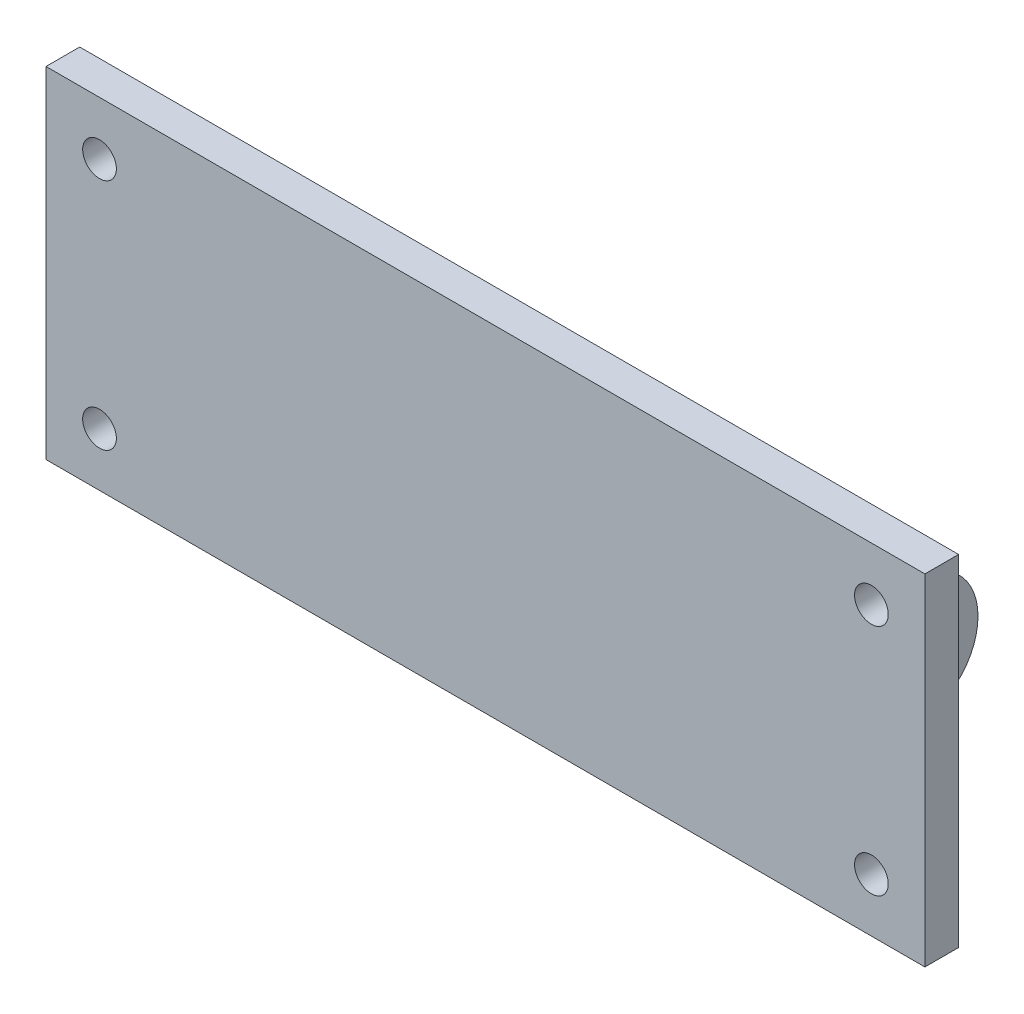
from build123d import *

# Parameters (mm, degrees)
SKETCH1_W           = 208.6
SKETCH1_H           = 80.8
SKETCH1_R           = 4
SKETCH1_W_2         = 20
SKETCH1_H_2         = 30
BOSS_EXTRUDE1_DEPTH = 8
SKETCH1_3_W         = 20
SKETCH1_3_H         = 30
BOSS_EXTRUDE2_DEPTH = 30
FILLET1_R           = 5
FILLET2_R           = 15
SKETCH2_R           = 5
CUT_EXTRUDE1_DEPTH  = 462.279122908


with BuildPart() as part:
    # Sketch1 → Boss-Extrude1 (new body)
    # profile 1 of 3: a face of its own
    with BuildSketch(Plane.XY):
        with Locations((21.844388387, -381.87501611)):
            Rectangle(SKETCH1_W, SKETCH1_H)
        with Locations((113.444388387, -409.57501611)):
            Circle(SKETCH1_R, mode=Mode.SUBTRACT)
        with Locations((-69.755611613, -354.17501611)):
            Circle(SKETCH1_R, mode=Mode.SUBTRACT)
        with Locations((-69.755611613, -409.57501611)):
            Circle(SKETCH1_R, mode=Mode.SUBTRACT)
        with Locations((113.444388387, -354.17501611)):
            Circle(SKETCH1_R, mode=Mode.SUBTRACT)
        with Locations((90.744388387, -381.87501611)):
            Rectangle(SKETCH1_W_2, SKETCH1_H_2, mode=Mode.SUBTRACT)
        with Locations((-47.055611613, -381.87501611)):
            Rectangle(SKETCH1_W_2, SKETCH1_H_2, mode=Mode.SUBTRACT)
    # profile 2 of 3: a face of its own
    with BuildSketch(Plane.XY):
        with Locations((-47.055611613, -381.87501611)):
            Rectangle(SKETCH1_W_2, SKETCH1_H_2)
    # profile 3 of 3: a face of its own
    with BuildSketch(Plane.XY):
        with Locations((90.744388387, -381.87501611)):
            Rectangle(SKETCH1_W_2, SKETCH1_H_2)
    extrude(amount=BOSS_EXTRUDE1_DEPTH)

    # Sketch1<3> → Boss-Extrude2 (add)
    with BuildSketch(Plane.XY):
        with Locations((90.744388387, -381.87501611)):
            Rectangle(SKETCH1_3_W, SKETCH1_3_H)
        with Locations((-47.055611613, -381.87501611)):
            Rectangle(SKETCH1_3_W, SKETCH1_3_H)
    extrude(amount=-BOSS_EXTRUDE2_DEPTH)

    # Fillet1
    fillet1_edges = [part.edges().sort_by_distance(p)[0] for p in [
        (90.744388387, -366.87501611, 0),
        (90.744388387, -396.87501611, 0),
        (-47.055611613, -366.87501611, 0),
        (-47.055611613, -396.87501611, 0),
    ]]
    fillet(fillet1_edges, radius=FILLET1_R)

    # Fillet2
    fillet2_edges = [part.edges().sort_by_distance(p)[0] for p in [
        (90.744388387, -366.87501611, -30),
        (90.744388387, -396.87501611, -30),
        (-47.055611613, -396.87501611, -30),
        (-47.055611613, -366.87501611, -30),
    ]]
    fillet(fillet2_edges, radius=FILLET2_R - 0.0001)  # a hair under: the kernel refuses the full size

    # Sketch2 → Cut-Extrude1 (cut, through all)
    with BuildSketch(Plane(origin=(100.744388387, 0, 0), x_dir=(0, 0, -1), z_dir=(1, 0, 0))):
        with Locations(Location((15, -381.87501611, 0), (0, 0, 90))):
            Circle(SKETCH2_R)
    extrude(amount=-CUT_EXTRUDE1_DEPTH, mode=Mode.SUBTRACT)


solid = part.part
